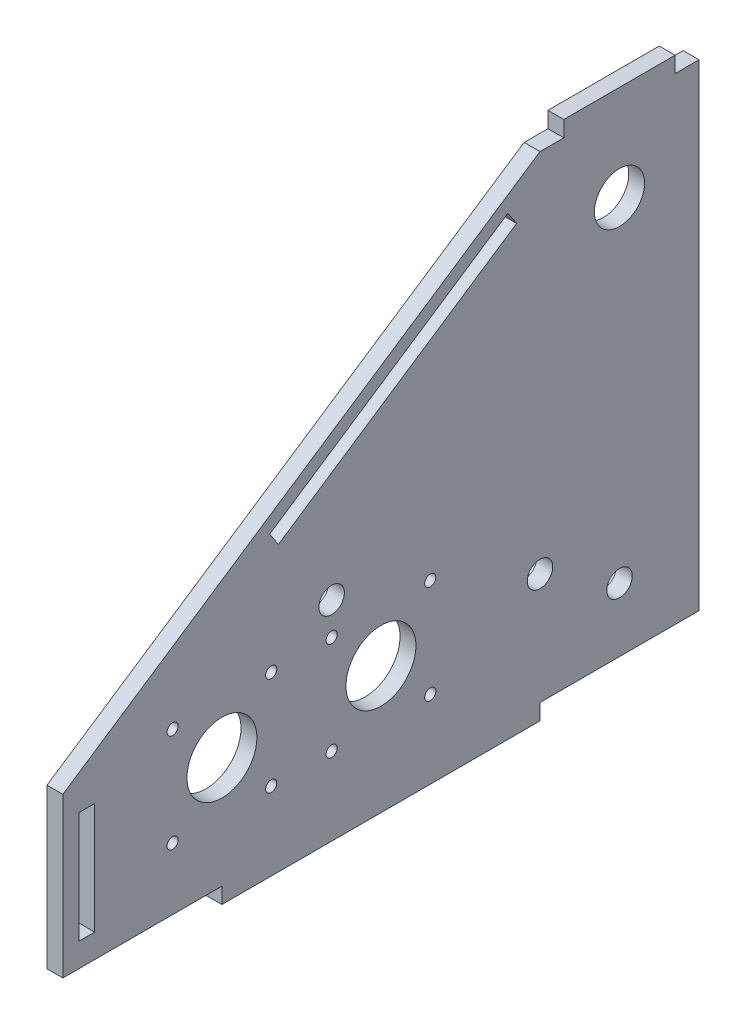
from build123d import *

# Parameters (mm, degrees)
CROQUIS1_R              = 7.9
CROQUIS1_R_2            = 4
CROQUIS1_R_3            = 11
CROQUIS1_R_4            = 1.75
CROQUIS1_W              = 5
CROQUIS1_H              = 35
SALIENTE_EXTRUIR1_DEPTH = 5


with BuildPart() as part:
    # Croquis1 → Saliente-Extruir1 (new body)
    with BuildSketch(Plane(origin=(0, 0, 0), x_dir=(0, 0, -1), z_dir=(1, 0, 0))):
        Polygon((150, 150), (0, 50), (0, 0), (50, 0), (50, -5), (150, -5), (150, 0), (200, 0), (200, 150), (192.5, 150), (192.5, 155), (157.5, 155), (157.5, 150), align=None)
        with Locations((175, 125)):
            Circle(CROQUIS1_R, mode=Mode.SUBTRACT)
        with Locations((175, 20)):
            Circle(CROQUIS1_R_2, mode=Mode.SUBTRACT)
        with Locations((150, 35)):
            Circle(CROQUIS1_R_2, mode=Mode.SUBTRACT)
        with Locations((100, 35)):
            Circle(CROQUIS1_R_3, mode=Mode.SUBTRACT)
        with Locations((84.5, 60.685599078)):
            Circle(CROQUIS1_R_2, mode=Mode.SUBTRACT)
        with Locations((84.5, 50.5)):
            Circle(CROQUIS1_R_4, mode=Mode.SUBTRACT)
        with Locations((115.5, 50.5)):
            Circle(CROQUIS1_R_4, mode=Mode.SUBTRACT)
        with Locations((115.5, 19.5)):
            Circle(CROQUIS1_R_4, mode=Mode.SUBTRACT)
        with Locations((84.5, 19.5)):
            Circle(CROQUIS1_R_4, mode=Mode.SUBTRACT)
        with Locations((50, 35)):
            Circle(CROQUIS1_R_3, mode=Mode.SUBTRACT)
        with Locations((34.5, 50.5)):
            Circle(CROQUIS1_R_4, mode=Mode.SUBTRACT)
        with Locations((65.5, 50.5)):
            Circle(CROQUIS1_R_4, mode=Mode.SUBTRACT)
        with Locations((65.5, 19.5)):
            Circle(CROQUIS1_R_4, mode=Mode.SUBTRACT)
        with Locations((34.5, 19.5)):
            Circle(CROQUIS1_R_4, mode=Mode.SUBTRACT)
        Polygon((65, 88.333333333), (139.88452649, 138.256350994), (142.658027472, 134.096099522), (67.773500981, 84.173081862), align=None, mode=Mode.SUBTRACT)
        with Locations((7.5, 25)):
            Rectangle(CROQUIS1_W, CROQUIS1_H, mode=Mode.SUBTRACT)
    extrude(amount=SALIENTE_EXTRUIR1_DEPTH)


solid = part.part
